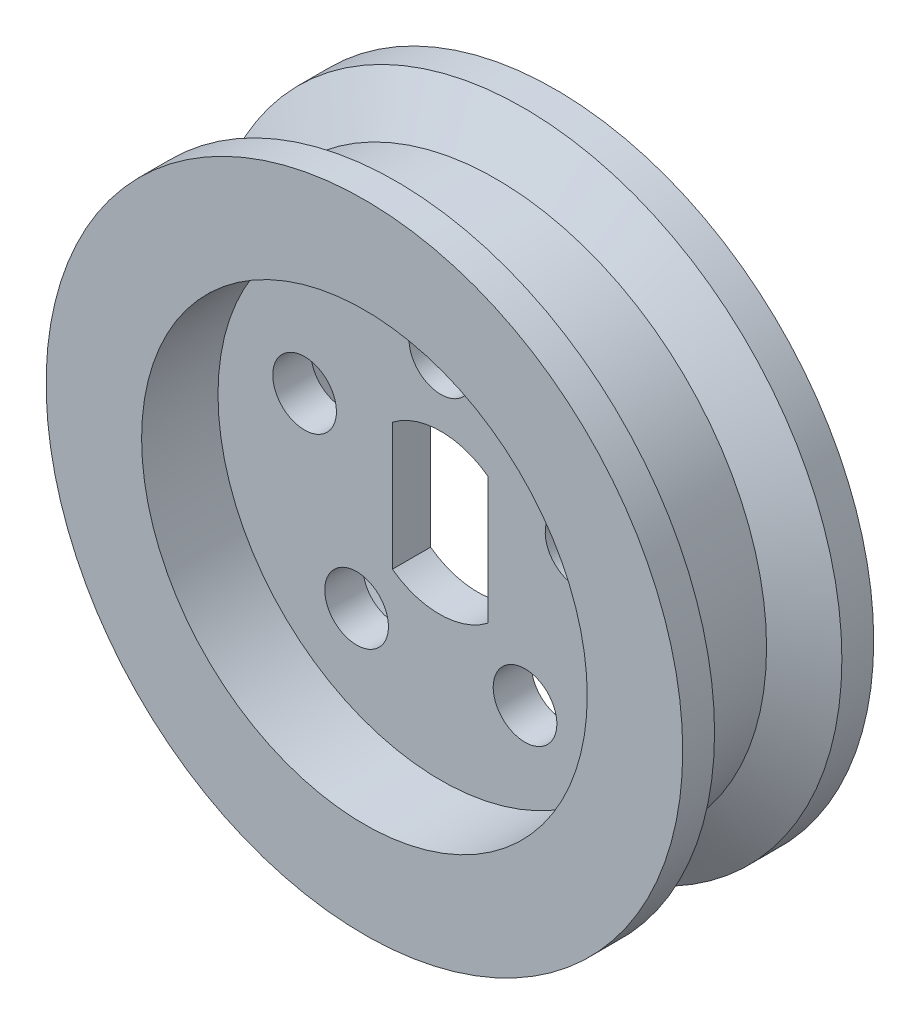
from build123d import *

# Parameters (mm, degrees)
SKETCH1_R           = 10
BOSS_EXTRUDE1_DEPTH = 3
SKETCH2_R           = 7
CUT_EXTRUDE1_DEPTH  = 2.4
SKETCH3_R           = 1
CUT_EXTRUDE2_DEPTH  = 15.593149078
CIRPATTERN1_COUNT   = 5


with BuildPart() as part:
    # Sketch1 → Boss-Extrude1 (new, symmetric)
    with BuildSketch(Plane.XY):
        Circle(SKETCH1_R)
        with BuildLine():
            Line((-1.521572539, 1.983637318), (-1.521572539, -2.016362682))
            ThreePointArc((-1.521572539, -2.016362682), (-0.016245384, -2.500087973), (1.478251514, -1.983871914))
            Line((1.478251514, -1.983871914), (1.478251514, 2.016128086))
            ThreePointArc((1.478251514, 2.016128086), (-0.02707564, 2.499853378), (-1.521572539, 1.983637318))
        make_face(mode=Mode.SUBTRACT)
    extrude(amount=BOSS_EXTRUDE1_DEPTH, both=True)

    # Sketch2 → Cut-Extrude1 (cut)
    with BuildSketch(Plane.XY.offset(3)):
        Circle(SKETCH2_R)
    cut_extrude1 = extrude(amount=-CUT_EXTRUDE1_DEPTH, mode=Mode.SUBTRACT)

    # Sketch3 → Cut-Extrude2 (cut, through all)
    with BuildSketch(Plane.XY.offset(0.6)):
        with Locations((0, 4.5)):
            Circle(SKETCH3_R)
    cut_extrude2 = extrude(amount=-CUT_EXTRUDE2_DEPTH, mode=Mode.SUBTRACT)

    # CirPattern1: Cut-Extrude2 ×5 about axis
    cirpattern1_axis = Axis((0, 0, 3), (0, 0, -1))
    for i in range(1, CIRPATTERN1_COUNT):
        add(cut_extrude2.rotate(cirpattern1_axis, i * 360 / CIRPATTERN1_COUNT), mode=Mode.SUBTRACT)

    # Mirror1: Cut-Extrude1 across plane
    add(cut_extrude1.mirror(Plane.XY), mode=Mode.SUBTRACT)

    # Sketch5 → Cut-Revolve1 (revolve, cut)
    with BuildSketch(Plane(origin=(0, 0, 0), x_dir=(1, 0, 0), z_dir=(0, 1, 0))):
        Polygon((-10, 2), (-8.5, 1.133974596), (-8.5, -1.133974596), (-10, -2), align=None)
    revolve(axis=Axis((0, 0, 0), (0, 0, -1)), mode=Mode.SUBTRACT)


solid = part.part
